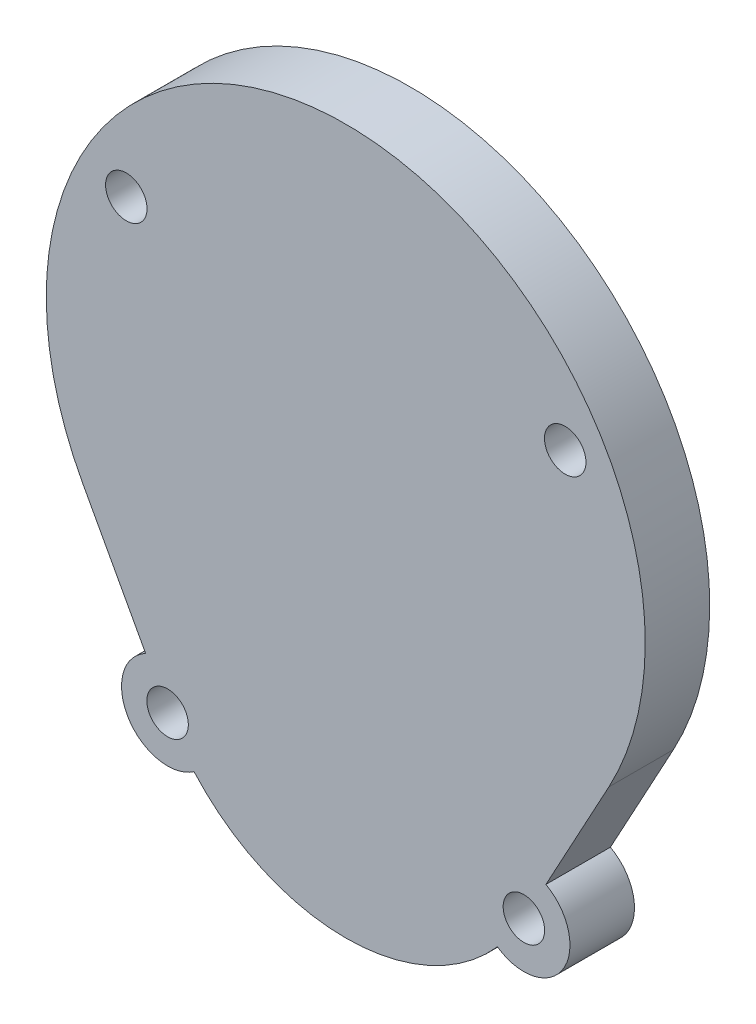
from build123d import *

# Parameters (mm, degrees)
SKETCH1_R           = 2.25
BOSS_EXTRUDE1_DEPTH = 7
BOSS_EXTRUDE2_START = 2
BOSS_EXTRUDE2_DEPTH = 2
SKETCH3_R           = 7.05
CUT_EXTRUDE1_DEPTH  = 5
SKETCH4_R           = 7.5
CUT_EXTRUDE2_DEPTH  = 2
CUT_EXTRUDE3_DEPTH  = 4


with BuildPart() as part:
    # Sketch1 → Boss-Extrude1 (new body)
    with BuildSketch(Plane.XY):
        with BuildLine():
            Line((-28.559544782, -15.511363636), (-21.718978566, -28.10622388))
            ThreePointArc((-21.718978566, -28.10622388), (-23.583461057, -35.132547662), (-16.46241644, -36.594137349))
            ThreePointArc((-16.46241644, -36.594137349), (0, -44), (16.46241644, -36.594137349))
            ThreePointArc((16.46241644, -36.594137349), (23.583461057, -35.132547662), (21.718978566, -28.10622388))
            Line((21.718978566, -28.10622388), (28.559544782, -15.511363636))
            ThreePointArc((28.559544782, -15.511363636), (0, 32.5), (-28.559544782, -15.511363636))
        make_face()
        with Locations((-23.815698604, 13.75)):
            Circle(SKETCH1_R, mode=Mode.SUBTRACT)
        with Locations((23.815698604, 13.75)):
            Circle(SKETCH1_R, mode=Mode.SUBTRACT)
        with Locations((-19.332614929, -32.5)):
            Circle(SKETCH1_R, mode=Mode.SUBTRACT)
        with Locations((19.332614929, -32.5)):
            Circle(SKETCH1_R, mode=Mode.SUBTRACT)
    extrude(amount=BOSS_EXTRUDE1_DEPTH)

    # Sketch2 → Boss-Extrude2 (add)
    with BuildSketch(Plane(origin=(0, 0, 0), x_dir=(-1, 0, 0), z_dir=(0, 0, -1)).offset(BOSS_EXTRUDE2_START)):
        with BuildLine():
            ThreePointArc((-24.392881026, 11.57529072), (-26.989983693, -0.735377638), (-23.726391049, -12.886363636))
            Line((-23.726391049, -12.886363636), (-14.499461197, -29.875))
            ThreePointArc((-14.499461197, -29.875), (0, -38.5), (14.499461197, -29.875))
            Line((14.499461197, -29.875), (23.726391049, -12.886363636))
            ThreePointArc((23.726391049, -12.886363636), (26.989983693, -0.735377638), (24.392881026, 11.57529072))
            ThreePointArc((24.392881026, 11.57529072), (21.867141446, 12.625), (22.220936333, 15.33720928))
            ThreePointArc((22.220936333, 15.33720928), (0, 27), (-22.220936333, 15.33720928))
            ThreePointArc((-22.220936333, 15.33720928), (-21.735949207, 14.60857), (-21.565698604, 13.75))
            ThreePointArc((-21.565698604, 13.75), (-22.443867793, 11.966581871), (-24.392881026, 11.57529072))
        make_face()
        with BuildLine():
            Line((-11.863195525, -28.443181818), (-21.090125377, -11.454545455))
            ThreePointArc((-21.090125377, -11.454545455), (0, 24), (21.090125377, -11.454545455))
            Line((21.090125377, -11.454545455), (11.863195525, -28.443181818))
            ThreePointArc((11.863195525, -28.443181818), (0, -35.5), (-11.863195525, -28.443181818))
        make_face(mode=Mode.SUBTRACT)
    extrude(amount=-BOSS_EXTRUDE2_DEPTH)

    # Sketch3 → Cut-Extrude1 (cut)
    with BuildSketch(Plane(origin=(0, 0, 0), x_dir=(-1, 0, 0), z_dir=(0, 0, -1))):
        with Locations((0, -22)):
            Circle(SKETCH3_R)
    extrude(amount=-CUT_EXTRUDE1_DEPTH, mode=Mode.SUBTRACT)

    # Sketch4 → Cut-Extrude2 (cut)
    with BuildSketch(Plane(origin=(0, 0, 0), x_dir=(-1, 0, 0), z_dir=(0, 0, -1))):
        Circle(SKETCH4_R)
    extrude(amount=-CUT_EXTRUDE2_DEPTH, mode=Mode.SUBTRACT)

    # Sketch5 → Cut-Extrude3 (cut)
    with BuildSketch(Plane(origin=(0, 0, 0), x_dir=(-1, 0, 0), z_dir=(0, 0, -1))):
        with BuildLine():
            Line((-17.937885599, -17.258453815), (-21.090125377, -11.454545455))
            ThreePointArc((-21.090125377, -11.454545455), (0, 24), (21.090125377, -11.454545455))
            Line((21.090125377, -11.454545455), (17.937885599, -17.258453815))
            ThreePointArc((17.937885599, -17.258453815), (15.130599111, -18.82175698), (12.519507213, -16.949065518))
            ThreePointArc((12.519507213, -16.949065518), (0, -8.5), (-12.519507213, -16.949065518))
            ThreePointArc((-12.519507213, -16.949065518), (-15.130599111, -18.82175698), (-17.937885599, -17.258453815))
        make_face()
    extrude(amount=-CUT_EXTRUDE3_DEPTH, mode=Mode.SUBTRACT)


solid = part.part
